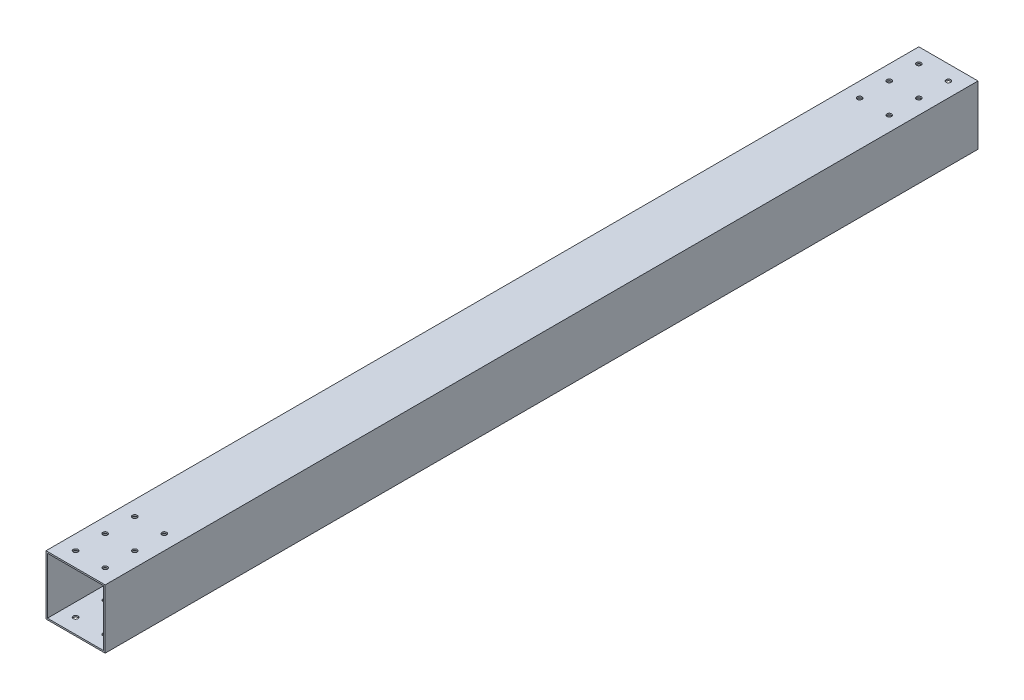
from build123d import *

# Parameters (mm, degrees)
SKETCH_1_W          = 40
SKETCH_1_H          = 40
SKETCH_1_W_2        = 38
SKETCH_1_H_2        = 38
EXTRUDE_1_DEPTH     = 295
SKETCH_2_R          = 1.6
CUT_EXTRUDE_1_DEPTH = 299.370574957
CUT_EXTRUDE_2_DEPTH = 10


with BuildPart() as part:
    # 草图1 → 凸台-拉伸1 (new, symmetric)
    with BuildSketch(Plane.XY):
        Rectangle(SKETCH_1_W, SKETCH_1_H)
        Rectangle(SKETCH_1_W_2, SKETCH_1_H_2, mode=Mode.SUBTRACT)
    extrude(amount=EXTRUDE_1_DEPTH, both=True)

    # 草图2 → 切除-拉伸1 (cut, through all)
    with BuildSketch(Plane(origin=(0, 20, 0), x_dir=(1, 0, 0), z_dir=(0, 1, 0))):
        with Locations((-10, -285)):
            Circle(SKETCH_2_R)
        with Locations((10, -285)):
            Circle(SKETCH_2_R)
        with Locations((-10, -265)):
            Circle(SKETCH_2_R)
        with Locations((10, -265)):
            Circle(SKETCH_2_R)
        with Locations((-10, -245)):
            Circle(SKETCH_2_R)
        with Locations((10, -245)):
            Circle(SKETCH_2_R)
        with Locations((10, 245)):
            Circle(SKETCH_2_R)
        with Locations((-10, 245)):
            Circle(SKETCH_2_R)
        with Locations((10, 265)):
            Circle(SKETCH_2_R)
        with Locations((-10, 265)):
            Circle(SKETCH_2_R)
        with Locations((10, 285)):
            Circle(SKETCH_2_R)
        with Locations((-10, 285)):
            Circle(SKETCH_2_R)
    extrude(amount=-CUT_EXTRUDE_1_DEPTH, mode=Mode.SUBTRACT)

    # 草图3 → 切除-拉伸2 (cut)
    with BuildSketch(Plane.ZY.offset(20)):
        with BuildLine():
            Line((-215, 17), (-200, 17))
            ThreePointArc((-200, 17), (-193, 10), (-200, 3))
            Line((-200, 3), (-215, 3))
            ThreePointArc((-215, 3), (-222, 10), (-215, 17))
        make_face()
        with BuildLine():
            Line((-95, 17), (-80, 17))
            ThreePointArc((-80, 17), (-73, 10), (-80, 3))
            Line((-80, 3), (-95, 3))
            ThreePointArc((-95, 3), (-102, 10), (-95, 17))
        make_face()
    extrude(amount=-CUT_EXTRUDE_2_DEPTH, mode=Mode.SUBTRACT)


solid = part.part
